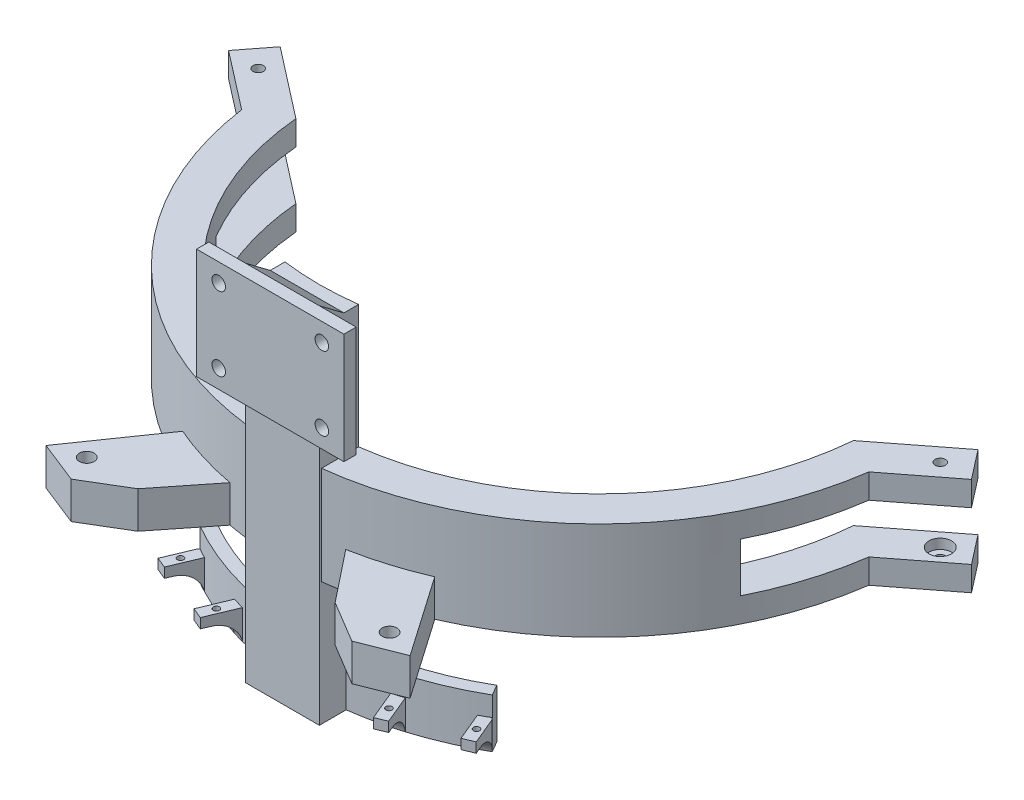
from build123d import *

# Parameters (mm, degrees)
SKETCH1_R            = 2.1
BOSS_EXTRUDE1_DEPTH  = 20
SKETCH4_W            = 70
SKETCH4_H            = 20
CUT_EXTRUDE3_DEPTH   = 175
BOSS_EXTRUDE2_DEPTH  = 70.25
BOSS_EXTRUDE4_START  = -20
BOSS_EXTRUDE4_DEPTH  = 20
SKETCH11_R           = 4.6
CUT_EXTRUDE5_DEPTH   = 14
BOSS_EXTRUDE6_START  = -5
BOSS_EXTRUDE6_DEPTH  = 15
SKETCH18_R           = 3
CUT_EXTRUDE7_DEPTH   = 30
SKETCH19_W           = 60
SKETCH19_H           = 45
SKETCH19_R           = 2.75
BOSS_EXTRUDE7_DEPTH  = 5
BOSS_EXTRUDE8_DEPTH  = 15
BOSS_EXTRUDE9_START  = -12
SKETCH21_R           = 1.25
BOSS_EXTRUDE9_DEPTH  = 4
FILLET1_R            = 10
FILLET1_OF_MIRROR3_R = 10


with BuildPart() as part:
    # Sketch1 → Boss-Extrude1 (new, symmetric)
    with BuildSketch(Plane(origin=(0, 0, 0), x_dir=(1, 0, 0), z_dir=(0, 1, 0))):
        with BuildLine():
            Line((127.750666484, -17.909975233), (151.311163425, 0.323882801))
            Line((151.311163425, 0.323882801), (142.122463143, 12.164659958))
            Line((142.122463143, 12.164659958), (113.560556533, -10))
            ThreePointArc((113.560556533, -10), (0, -114), (-113.560556533, -10))
            Line((-113.560556533, -10), (-142.122463143, 12.164659958))
            Line((-142.122463143, 12.164659958), (-151.311112445, 0.323948494))
            Line((-151.311112445, 0.323948494), (-127.750666484, -17.909975233))
            ThreePointArc((-127.750666484, -17.909975233), (0, -129), (127.750666484, -17.909975233))
        make_face()
        with Locations(Location((138.904661228, 0, 0), (0, 0, 270))):
            Circle(SKETCH1_R, mode=Mode.SUBTRACT)
        with Locations(Location((-138.904661228, 0, 0), (0, 0, 270))):
            Circle(SKETCH1_R, mode=Mode.SUBTRACT)
    extrude(amount=BOSS_EXTRUDE1_DEPTH, both=True)

    # Sketch4 → Cut-Extrude3 (cut, symmetric)
    with BuildSketch(Plane(origin=(0, 0, 0), x_dir=(0, 0, -1), z_dir=(1, 0, 0))):
        with Locations((-22.835340042, 0)):
            Rectangle(SKETCH4_W, SKETCH4_H)
    extrude(amount=CUT_EXTRUDE3_DEPTH, both=True, mode=Mode.SUBTRACT)

    # Sketch6 → Boss-Extrude2 (add, symmetric)
    with BuildSketch(Plane(origin=(0, 0, 0), x_dir=(1, 0, 0), z_dir=(0, 1, 0))):
        with BuildLine():
            Line((-15, -113.008849211), (-15, -129))
            Line((-15, -129), (15, -129))
            Line((15, -129), (15, -113.008849211))
            ThreePointArc((15, -113.008849211), (0, -114), (-15, -113.008849211))
        make_face()
    extrude(amount=BOSS_EXTRUDE2_DEPTH, both=True)

    # Sketch8 → Boss-Extrude4 (add)
    with BuildSketch(Plane.XZ.offset(70.25).offset(BOSS_EXTRUDE4_START)):
        with BuildLine():
            ThreePointArc((15, 118.050836507), (0, 119), (-15, 118.050836507))
            Line((-15, 118.050836507), (-15, 113.008849211))
            ThreePointArc((-15, 113.008849211), (0, 114), (15, 113.008849211))
            Line((15, 113.008849211), (15, 118.050836507))
        make_face()
        with BuildLine():
            ThreePointArc((-15, 118.050836507), (-37.996922382, 112.770713794), (-59.5, 103.05702305))
            Line((-59.5, 103.05702305), (-56.968949692, 98.744816426))
            ThreePointArc((-56.968949692, 98.744816426), (-36.684439314, 107.936332679), (-15, 113.008849211))
            Line((-15, 113.008849211), (-15, 118.050836507))
        make_face()
        with BuildLine():
            ThreePointArc((59.5, 103.05702305), (37.996922382, 112.770713794), (15, 118.050836507))
            Line((15, 118.050836507), (15, 113.008849211))
            ThreePointArc((15, 113.008849211), (36.70141069, 107.93056311), (57, 98.726896031))
            Line((57, 98.726896031), (59.5, 103.05702305))
        make_face()
    extrude(amount=BOSS_EXTRUDE4_DEPTH)

    # Sketch11 → Cut-Extrude5 (cut, symmetric)
    with BuildSketch(Plane(origin=(0, 0, 0), x_dir=(1, 0, 0), z_dir=(0, 1, 0))):
        with Locations(Location((-138.904661228, 0, 0), (0, 0, 270))):
            Circle(SKETCH11_R)
        with Locations(Location((138.904661228, 0, 0), (0, 0, 270))):
            Circle(SKETCH11_R)
    extrude(amount=CUT_EXTRUDE5_DEPTH, both=True, mode=Mode.SUBTRACT)

    # Sketch12 → Boss-Extrude6 (add)
    with BuildSketch(Plane(origin=(0, 0, 0), x_dir=(1, 0, 0), z_dir=(0, 1, 0)).offset(BOSS_EXTRUDE6_START)):
        with BuildLine():
            Line((-74.155052848, -151.198146724), (-51.337009812, -118.344883386))
            ThreePointArc((-51.337009812, -118.344883386), (-37.693209382, -123.370263705), (-23.570553347, -126.828344683))
            Line((-23.570553347, -126.828344683), (-40.189742238, -147.75961229))
            Line((-40.189742238, -147.75961229), (-57.175126894, -157.923557325))
            Line((-57.175126894, -157.923557325), (-74.155052848, -151.198146724))
        make_face()
    boss_extrude6 = extrude(amount=-BOSS_EXTRUDE6_DEPTH)

    # Sketch18 → Cut-Extrude7 (cut)
    with BuildSketch(Plane(origin=(0, 0, 0), x_dir=(1, 0, 0), z_dir=(0, 1, 0))):
        with Locations(Location((-61.679636046, -147.068233703, 0), (0, 0, 270))):
            Circle(SKETCH18_R)
    cut_extrude7 = extrude(amount=-CUT_EXTRUDE7_DEPTH, mode=Mode.SUBTRACT)

    # Mirror2: Boss-Extrude6, Cut-Extrude7 across plane
    add(boss_extrude6.mirror(Plane(origin=(0, 0, 0), x_dir=(0, 0, 1), z_dir=(1, 0, 0))))
    add(cut_extrude7.mirror(Plane(origin=(0, 0, 0), x_dir=(0, 0, 1), z_dir=(1, 0, 0))), mode=Mode.SUBTRACT)

    # Sketch19 → Boss-Extrude7 (add)
    with BuildSketch(Plane.XY.offset(129)):
        with Locations((0, 55.25)):
            Rectangle(SKETCH19_W, SKETCH19_H)
        with Locations((-21, 70.25)):
            Circle(SKETCH19_R, mode=Mode.SUBTRACT)
        with Locations((21, 70.25)):
            Circle(SKETCH19_R, mode=Mode.SUBTRACT)
        with Locations((21, 40.25)):
            Circle(SKETCH19_R, mode=Mode.SUBTRACT)
        with Locations((-21, 40.25)):
            Circle(SKETCH19_R, mode=Mode.SUBTRACT)
    extrude(amount=BOSS_EXTRUDE7_DEPTH)

    # Sketch20 → Boss-Extrude8 (add, symmetric)
    with BuildSketch(Plane(origin=(0, 0, 0), x_dir=(0, 0, -1), z_dir=(1, 0, 0))):
        Polygon((-129, 77.75), (-119, 70.25), (-129, 70.25), align=None)
    extrude(amount=BOSS_EXTRUDE8_DEPTH, both=True)

    # Sketch21 → Boss-Extrude9 (add)
    # profile 1 of 2: a face of its own
    with BuildSketch(Plane.XZ.offset(70.25).offset(BOSS_EXTRUDE9_START)):
        with BuildLine():
            Line((60.166349878, 103.82338781), (64.796594843, 114.89410737))
            Line((64.796594843, 114.89410737), (60.414435017, 116.726912668))
            Line((60.414435017, 116.726912668), (55.784190052, 105.656193109))
            Line((55.784190052, 105.656193109), (55.598819688, 105.212980422))
            ThreePointArc((55.598819688, 105.212980422), (57.559504962, 104.153268737), (59.5, 103.05702305))
            Line((59.5, 103.05702305), (60.166349878, 103.82338781))
        make_face()
        with Locations(Location((60.290392447, 110.275150239, 0), (0, 0, 270))):
            Circle(SKETCH21_R, mode=Mode.SUBTRACT)
    # profile 2 of 2: a face of its own
    with BuildSketch(Plane.XZ.offset(70.25).offset(BOSS_EXTRUDE9_START)):
        with BuildLine():
            Line((30.644431053, 116.170707717), (35.274676018, 127.241427276))
            Line((35.274676018, 127.241427276), (39.656835843, 125.408621978))
            Line((39.656835843, 125.408621978), (35.026590878, 114.337902418))
            Line((35.026590878, 114.337902418), (34.800651814, 113.797691687))
            ThreePointArc((34.800651814, 113.797691687), (32.506146579, 114.474234807), (30.198505599, 115.104518849))
            Line((30.198505599, 115.104518849), (30.644431053, 116.170707717))
        make_face()
        with Locations(Location((35.150633448, 120.789664847, 0), (0, 0, 270))):
            Circle(SKETCH21_R, mode=Mode.SUBTRACT)
    boss_extrude9 = extrude(amount=BOSS_EXTRUDE9_DEPTH)

    # Fillet1
    # the kernel refuses this fillet: 10 mm, written as the material it adds along each edge
    with BuildSketch(Plane(origin=(0, -62.25, 0), x_dir=(0.2766448328976998, 0, 0.9609722349948533), z_dir=(-0.9609722349948533, 0, 0.2766448328976998))) as fillet1_piece_1_section:
        with BuildLine():
            CenterArc((128.797958971, -10), FILLET1_R, 90, 78.463040967)
            Line((128.797958971, 0), (128.797958971, 0.2))
            Line((128.797958971, 0.2), (119, 0.2))
            Line((119, 0.2), (118.8, 0))
            ThreePointArc((118.8, 0), (118.8, -4), (118.804040821, -7.96))
            Line((118.804040821, -7.96), (119, -8))
        make_face()
    fillet1_piece_1 = revolve(axis=Axis((0, -62.25, 0), (0, 1, 0)), revolution_arc=13.939940526, mode=Mode.PRIVATE)
    fillet1_piece_1 = split(fillet1_piece_1, bisect_by=Plane(origin=(35.661833794, -64.203277533, 115.85674132), z_dir=(-0.9225599632877974, 0, 0.38585374708355274)), keep=Keep.TOP, mode=Mode.PRIVATE)
    fillet1_piece_1 = fillet1_piece_1 - Plane(origin=(35.150633448, -64.203277533, 120.789664847), x_dir=(0, 0, -1), z_dir=(0, 1, 0)) * Cylinder(1.25, 516, mode=Mode.PRIVATE)
    add(fillet1_piece_1)
    with BuildSketch(Plane(origin=(0, -62.25, 0), x_dir=(0.2766448328976998, 0, 0.9609722349948533), z_dir=(-0.9609722349948533, 0, 0.2766448328976998))) as fillet1_piece_2_section:
        with BuildLine():
            CenterArc((128.797958971, -10), FILLET1_R, 90, 78.463040967)
            Line((128.797958971, 0), (128.797958971, 0.2))
            Line((128.797958971, 0.2), (119, 0.2))
            Line((119, 0.2), (118.8, 0))
            ThreePointArc((118.8, 0), (118.8, -4), (118.804040821, -7.96))
            Line((118.804040821, -7.96), (119, -8))
        make_face()
    fillet1_piece_2 = revolve(axis=Axis((0, -62.25, 0), (0, 1, 0)), revolution_arc=13.939940526, mode=Mode.PRIVATE)
    fillet1_piece_2 = split(fillet1_piece_2, bisect_by=Plane(origin=(56.357377359, -64.275296016, 107.026659679), z_dir=(0.9225599632877974, 0, -0.38585374708355225)), keep=Keep.TOP, mode=Mode.PRIVATE)
    fillet1_piece_2 = split(fillet1_piece_2, bisect_by=Plane(origin=(60.589444621, -64.275296016, 104.309986386), z_dir=(-0.7546319780547139, 0, 0.6561482894111892)), keep=Keep.TOP, mode=Mode.PRIVATE)
    fillet1_piece_2 = split(fillet1_piece_2, bisect_by=Plane(origin=(60.739537185, -64.275296016, 105.19385438), z_dir=(-0.9225599632877975, 0, 0.3858537470835518)), keep=Keep.TOP, mode=Mode.PRIVATE)
    fillet1_piece_2 = fillet1_piece_2 - Plane(origin=(60.290392447, -64.275296016, 110.275150239), x_dir=(0, 0, -1), z_dir=(0, 1, 0)) * Cylinder(1.25, 516, mode=Mode.PRIVATE)
    add(fillet1_piece_2)
    with BuildSketch(Plane(origin=(0, -62.25, 0), x_dir=(0.2766448328976998, 0, 0.9609722349948533), z_dir=(-0.9609722349948533, 0, 0.2766448328976998))) as fillet1_piece_3_section:
        with BuildLine():
            CenterArc((128.797958971, -10), FILLET1_R, 90, 78.463040967)
            Line((128.797958971, 0), (128.797958971, 0.2))
            Line((128.797958971, 0.2), (119, 0.2))
            Line((119, 0.2), (118.8, 0))
            ThreePointArc((118.8, 0), (118.8, -4), (118.804040821, -7.96))
            Line((118.804040821, -7.96), (119, -8))
        make_face()
    fillet1_piece_3 = revolve(axis=Axis((0, -62.25, 0), (0, 1, 0)), revolution_arc=25.733676347, mode=Mode.PRIVATE)
    fillet1_piece_3 = split(fillet1_piece_3, bisect_by=Plane(origin=(60.039839713, -64.759244719, 103.992052862), z_dir=(0.8660254037844383, 0, -0.5000000000000009)), keep=Keep.TOP, mode=Mode.PRIVATE)
    fillet1_piece_3 = split(fillet1_piece_3, bisect_by=Plane(origin=(60.203541228, -64.759244719, 103.866161346), z_dir=(-0.7546319780547139, 0, 0.6561482894111892)), keep=Keep.TOP, mode=Mode.PRIVATE)
    fillet1_piece_3 = split(fillet1_piece_3, bisect_by=Plane(origin=(60.204366491, -64.759244719, 103.914283923), z_dir=(-0.9225599632877975, 0, 0.3858537470835518)), keep=Keep.TOP, mode=Mode.PRIVATE)
    add(fillet1_piece_3)
    with BuildSketch(Plane(origin=(0, -62.25, 0), x_dir=(0.2766448328976998, 0, 0.9609722349948533), z_dir=(-0.9609722349948533, 0, 0.2766448328976998))) as fillet1_piece_4_section:
        with BuildLine():
            CenterArc((128.797958971, -10), FILLET1_R, 90, 78.463040967)
            Line((128.797958971, 0), (128.797958971, 0.2))
            Line((128.797958971, 0.2), (119, 0.2))
            Line((119, 0.2), (118.8, 0))
            ThreePointArc((118.8, 0), (118.8, -4), (118.804040821, -7.96))
            Line((118.804040821, -7.96), (119, -8))
        make_face()
    fillet1_piece_4 = revolve(axis=Axis((0, -62.25, 0), (0, 1, 0)), revolution_arc=13.939940526, mode=Mode.PRIVATE)
    fillet1_piece_4 = split(fillet1_piece_4, bisect_by=Plane(origin=(59.412998603, -66.176203003, 102.956963297), z_dir=(0.7546319780547139, 0, -0.6561482894111892)), keep=Keep.TOP, mode=Mode.PRIVATE)
    add(fillet1_piece_4)
    with BuildSketch(Plane(origin=(0, -62.25, 0), x_dir=(0.48172270294266006, 0, 0.8763237058699358), z_dir=(0.8763237058699358, 0, -0.48172270294266006))) as fillet1_piece_5_section:
        with BuildLine():
            CenterArc((128.797958971, 10), FILLET1_R, 191.536959033, 78.463040967)
            Line((128.797958971, 0), (128.797958971, -0.2))
            Line((128.797958971, -0.2), (119, -0.2))
            Line((119, -0.2), (118.8, 0))
            ThreePointArc((118.8, 0), (118.8, 4), (118.804040821, 7.96))
            Line((118.804040821, 7.96), (119, 8))
        make_face()
    fillet1_piece_5 = revolve(axis=Axis((0, -62.25, 0), (0, -1, 0)), revolution_arc=25.891059079, mode=Mode.PRIVATE)
    fillet1_piece_5 = split(fillet1_piece_5, bisect_by=Plane(origin=(56.458000525, -64.212245059, 107.267245406), z_dir=(0.9225599632877974, 0, -0.38585374708355225)), keep=Keep.TOP, mode=Mode.PRIVATE)
    fillet1_piece_5 = fillet1_piece_5 - Plane(origin=(60.290392447, -64.212245059, 110.275150239), x_dir=(0, 0, -1), z_dir=(0, 1, 0)) * Cylinder(1.25, 516, mode=Mode.PRIVATE)
    add(fillet1_piece_5)
    with BuildSketch(Plane(origin=(0, -62.25, 0), x_dir=(0.48172270294266006, 0, 0.8763237058699358), z_dir=(0.8763237058699358, 0, -0.48172270294266006))) as fillet1_piece_6_section:
        with BuildLine():
            CenterArc((128.797958971, 10), FILLET1_R, 191.536959033, 78.463040967)
            Line((128.797958971, 0), (128.797958971, -0.2))
            Line((128.797958971, -0.2), (119, -0.2))
            Line((119, -0.2), (118.8, 0))
            ThreePointArc((118.8, 0), (118.8, 4), (118.804040821, 7.96))
            Line((118.804040821, 7.96), (119, 8))
        make_face()
    fillet1_piece_6 = revolve(axis=Axis((0, -62.25, 0), (0, -1, 0)), revolution_arc=25.891059079, mode=Mode.PRIVATE)
    fillet1_piece_6 = split(fillet1_piece_6, bisect_by=Plane(origin=(35.532601608, -64.302459929, 115.547752637), z_dir=(-0.9225599632877974, 0, 0.38585374708355274)), keep=Keep.TOP, mode=Mode.PRIVATE)
    fillet1_piece_6 = split(fillet1_piece_6, bisect_by=Plane(origin=(31.150441782, -64.302459929, 117.380557936), z_dir=(0.9225599632877988, 0, -0.3858537470835492)), keep=Keep.TOP, mode=Mode.PRIVATE)
    fillet1_piece_6 = fillet1_piece_6 - Plane(origin=(35.150633448, -64.302459929, 120.789664847), x_dir=(0, 0, -1), z_dir=(0, 1, 0)) * Cylinder(1.25, 516, mode=Mode.PRIVATE)
    add(fillet1_piece_6)

    # Mirror3: Boss-Extrude9 across plane
    add(boss_extrude9.mirror(Plane(origin=(0, 0, 0), x_dir=(0, 0, 1), z_dir=(1, 0, 0))))

    # Fillet1 of Mirror3
    # the kernel refuses this fillet: 10 mm, written as the material it adds along each edge
    with BuildSketch(Plane(origin=(0, -62.25, 0), x_dir=(-0.27664483289770714, 0, 0.9609722349948513), z_dir=(0.9609722349948513, 0, 0.27664483289770714))) as fillet1_of_mirror3_piece_1_section:
        with BuildLine():
            CenterArc((128.797958971, 10), FILLET1_OF_MIRROR3_R, 191.536959033, 78.463040967)
            Line((128.797958971, 0), (128.797958971, -0.2))
            Line((128.797958971, -0.2), (119, -0.2))
            Line((119, -0.2), (118.8, 0))
            ThreePointArc((118.8, 0), (118.8, 4), (118.804040821, 7.96))
            Line((118.804040821, 7.96), (119, 8))
        make_face()
    fillet1_of_mirror3_piece_1 = revolve(axis=Axis((0, -62.25, 0), (0, -1, 0)), revolution_arc=25.733676347, mode=Mode.PRIVATE)
    fillet1_of_mirror3_piece_1 = split(fillet1_of_mirror3_piece_1, bisect_by=Plane(origin=(-35.661833794, -64.203277533, 115.85674132), z_dir=(0.9225599632877974, 0, 0.38585374708355274)), keep=Keep.TOP, mode=Mode.PRIVATE)
    fillet1_of_mirror3_piece_1 = fillet1_of_mirror3_piece_1 - Plane(origin=(-35.150633448, -64.203277533, 120.789664847), x_dir=(0, 0, -1), z_dir=(0, 1, 0)) * Cylinder(1.25, 516, mode=Mode.PRIVATE)
    add(fillet1_of_mirror3_piece_1)
    with BuildSketch(Plane(origin=(0, -62.25, 0), x_dir=(-0.27664483289770714, 0, 0.9609722349948513), z_dir=(0.9609722349948513, 0, 0.27664483289770714))) as fillet1_of_mirror3_piece_2_section:
        with BuildLine():
            CenterArc((128.797958971, 10), FILLET1_OF_MIRROR3_R, 191.536959033, 78.463040967)
            Line((128.797958971, 0), (128.797958971, -0.2))
            Line((128.797958971, -0.2), (119, -0.2))
            Line((119, -0.2), (118.8, 0))
            ThreePointArc((118.8, 0), (118.8, 4), (118.804040821, 7.96))
            Line((118.804040821, 7.96), (119, 8))
        make_face()
    fillet1_of_mirror3_piece_2 = revolve(axis=Axis((0, -62.25, 0), (0, -1, 0)), revolution_arc=25.733676347, mode=Mode.PRIVATE)
    fillet1_of_mirror3_piece_2 = split(fillet1_of_mirror3_piece_2, bisect_by=Plane(origin=(-60.584599556, -64.275422034, 104.904879404), z_dir=(0.8624181842668756, 0, 0.5061964790926794)), keep=Keep.TOP, mode=Mode.PRIVATE)
    fillet1_of_mirror3_piece_2 = split(fillet1_of_mirror3_piece_2, bisect_by=Plane(origin=(-56.35703825, -64.275422034, 107.025848882), z_dir=(-0.9225599632877974, 0, -0.38585374708355225)), keep=Keep.TOP, mode=Mode.PRIVATE)
    fillet1_of_mirror3_piece_2 = split(fillet1_of_mirror3_piece_2, bisect_by=Plane(origin=(-60.589338804, -64.275422034, 104.309864686), z_dir=(0.7546319780547139, 0, 0.6561482894111892)), keep=Keep.TOP, mode=Mode.PRIVATE)
    fillet1_of_mirror3_piece_2 = split(fillet1_of_mirror3_piece_2, bisect_by=Plane(origin=(-60.739198076, -64.275422034, 105.193043584), z_dir=(0.9225599632877975, 0, 0.3858537470835518)), keep=Keep.TOP, mode=Mode.PRIVATE)
    fillet1_of_mirror3_piece_2 = fillet1_of_mirror3_piece_2 - Plane(origin=(-60.290392447, -64.275422034, 110.275150239), x_dir=(0, 0, -1), z_dir=(0, 1, 0)) * Cylinder(1.25, 516, mode=Mode.PRIVATE)
    add(fillet1_of_mirror3_piece_2)
    with BuildSketch(Plane(origin=(0, -62.25, 0), x_dir=(-0.27664483289770714, 0, 0.9609722349948513), z_dir=(0.9609722349948513, 0, 0.27664483289770714))) as fillet1_of_mirror3_piece_3_section:
        with BuildLine():
            CenterArc((128.797958971, 10), FILLET1_OF_MIRROR3_R, 191.536959033, 78.463040967)
            Line((128.797958971, 0), (128.797958971, -0.2))
            Line((128.797958971, -0.2), (119, -0.2))
            Line((119, -0.2), (118.8, 0))
            ThreePointArc((118.8, 0), (118.8, 4), (118.804040821, 7.96))
            Line((118.804040821, 7.96), (119, 8))
        make_face()
    fillet1_of_mirror3_piece_3 = revolve(axis=Axis((0, -62.25, 0), (0, -1, 0)), revolution_arc=25.733676347, mode=Mode.PRIVATE)
    fillet1_of_mirror3_piece_3 = split(fillet1_of_mirror3_piece_3, bisect_by=Plane(origin=(-60.028777386, -64.787778303, 103.957912827), z_dir=(-0.8624181842668756, 0, -0.5061964790926794)), keep=Keep.TOP, mode=Mode.PRIVATE)
    fillet1_of_mirror3_piece_3 = split(fillet1_of_mirror3_piece_3, bisect_by=Plane(origin=(-60.181261206, -64.787778303, 103.840537234), z_dir=(0.7546319780547139, 0, 0.6561482894111892)), keep=Keep.TOP, mode=Mode.PRIVATE)
    fillet1_of_mirror3_piece_3 = split(fillet1_of_mirror3_piece_3, bisect_by=Plane(origin=(-60.190522415, -64.787778303, 103.881183323), z_dir=(0.9225599632877975, 0, 0.3858537470835518)), keep=Keep.TOP, mode=Mode.PRIVATE)
    add(fillet1_of_mirror3_piece_3)
    with BuildSketch(Plane(origin=(0, -62.25, 0), x_dir=(-0.27664483289770714, 0, 0.9609722349948513), z_dir=(0.9609722349948513, 0, 0.27664483289770714))) as fillet1_of_mirror3_piece_4_section:
        with BuildLine():
            CenterArc((128.797958971, 10), FILLET1_OF_MIRROR3_R, 191.536959033, 78.463040967)
            Line((128.797958971, 0), (128.797958971, -0.2))
            Line((128.797958971, -0.2), (119, -0.2))
            Line((119, -0.2), (118.8, 0))
            ThreePointArc((118.8, 0), (118.8, 4), (118.804040821, 7.96))
            Line((118.804040821, 7.96), (119, 8))
        make_face()
    fillet1_of_mirror3_piece_4 = revolve(axis=Axis((0, -62.25, 0), (0, -1, 0)), revolution_arc=25.733676347, mode=Mode.PRIVATE)
    fillet1_of_mirror3_piece_4 = split(fillet1_of_mirror3_piece_4, bisect_by=Plane(origin=(-59.432846096, -66.176202998, 102.942611452), z_dir=(0.8624181842668756, 0, 0.5061964790926794)), keep=Keep.TOP, mode=Mode.PRIVATE)
    fillet1_of_mirror3_piece_4 = split(fillet1_of_mirror3_piece_4, bisect_by=Plane(origin=(-59.412939029, -66.176202998, 102.956894781), z_dir=(-0.7546319780547139, 0, -0.6561482894111892)), keep=Keep.TOP, mode=Mode.PRIVATE)
    add(fillet1_of_mirror3_piece_4)
    with BuildSketch(Plane(origin=(0, -62.25, 0), x_dir=(-0.4817227029426563, 0, 0.8763237058699378), z_dir=(-0.8763237058699378, 0, -0.4817227029426563))) as fillet1_of_mirror3_piece_5_section:
        with BuildLine():
            CenterArc((128.797958971, -10), FILLET1_OF_MIRROR3_R, 90, 78.463040967)
            Line((128.797958971, 0), (128.797958971, 0.2))
            Line((128.797958971, 0.2), (119, 0.2))
            Line((119, 0.2), (118.8, 0))
            ThreePointArc((118.8, 0), (118.8, -4), (118.804040821, -7.96))
            Line((118.804040821, -7.96), (119, -8))
        make_face()
    fillet1_of_mirror3_piece_5 = revolve(axis=Axis((0, -62.25, 0), (0, 1, 0)), revolution_arc=25.891059079, mode=Mode.PRIVATE)
    fillet1_of_mirror3_piece_5 = split(fillet1_of_mirror3_piece_5, bisect_by=Plane(origin=(-56.458000525, -64.212245059, 107.267245406), z_dir=(-0.9225599632877974, 0, -0.38585374708355225)), keep=Keep.TOP, mode=Mode.PRIVATE)
    fillet1_of_mirror3_piece_5 = fillet1_of_mirror3_piece_5 - Plane(origin=(-60.290392447, -64.212245059, 110.275150239), x_dir=(0, 0, -1), z_dir=(0, 1, 0)) * Cylinder(1.25, 516, mode=Mode.PRIVATE)
    add(fillet1_of_mirror3_piece_5)
    with BuildSketch(Plane(origin=(0, -62.25, 0), x_dir=(-0.4817227029426563, 0, 0.8763237058699378), z_dir=(-0.8763237058699378, 0, -0.4817227029426563))) as fillet1_of_mirror3_piece_6_section:
        with BuildLine():
            CenterArc((128.797958971, -10), FILLET1_OF_MIRROR3_R, 90, 78.463040967)
            Line((128.797958971, 0), (128.797958971, 0.2))
            Line((128.797958971, 0.2), (119, 0.2))
            Line((119, 0.2), (118.8, 0))
            ThreePointArc((118.8, 0), (118.8, -4), (118.804040821, -7.96))
            Line((118.804040821, -7.96), (119, -8))
        make_face()
    fillet1_of_mirror3_piece_6 = revolve(axis=Axis((0, -62.25, 0), (0, 1, 0)), revolution_arc=25.891059079, mode=Mode.PRIVATE)
    fillet1_of_mirror3_piece_6 = split(fillet1_of_mirror3_piece_6, bisect_by=Plane(origin=(-31.150441782, -64.302459929, 117.380557936), z_dir=(-0.9225599632877988, 0, -0.3858537470835492)), keep=Keep.TOP, mode=Mode.PRIVATE)
    fillet1_of_mirror3_piece_6 = split(fillet1_of_mirror3_piece_6, bisect_by=Plane(origin=(-35.532601608, -64.302459929, 115.547752637), z_dir=(0.9225599632877974, 0, 0.38585374708355274)), keep=Keep.TOP, mode=Mode.PRIVATE)
    fillet1_of_mirror3_piece_6 = fillet1_of_mirror3_piece_6 - Plane(origin=(-35.150633448, -64.302459929, 120.789664847), x_dir=(0, 0, -1), z_dir=(0, 1, 0)) * Cylinder(1.25, 516, mode=Mode.PRIVATE)
    add(fillet1_of_mirror3_piece_6)


solid = part.part
